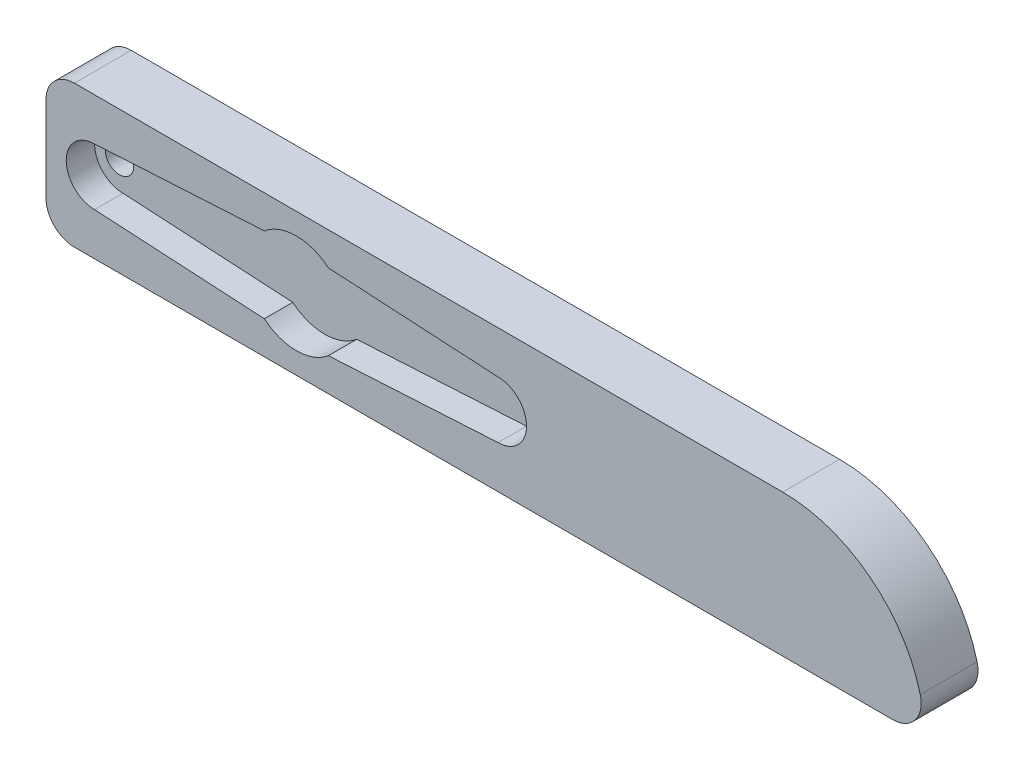
from build123d import *

# Parameters (mm, degrees)
SKETCH1_W           = 50
SKETCH1_H           = 10
BOSS_EXTRUDE1_DEPTH = 4
CUT_EXTRUDE1_DEPTH  = 2
CUT_EXTRUDE2_REACH  = 27.573
SKETCH3_R           = 1
CUT_EXTRUDE3_REACH  = 27.807
SKETCH4_W           = 8.712551382
SKETCH4_H           = 15.185608923
SKETCH5_W           = 19.235166375
SKETCH5_H           = 10
BOSS_EXTRUDE2_DEPTH = 4
FILLET1_R           = 10
FILLET2_R           = 2
FILLET3_R           = 2
FILLET4_R           = 2


with BuildPart() as part:
    # Sketch1 → Boss-Extrude1 (new body)
    with BuildSketch(Plane.XY):
        Rectangle(SKETCH1_W, SKETCH1_H)
    extrude(amount=BOSS_EXTRUDE1_DEPTH)

    # Sketch2 → Cut-Extrude1 (cut)
    with BuildSketch(Plane.XY.offset(4)):
        with BuildLine():
            Line((-2.254530133, 2.677142857), (-14.2, 2))
            ThreePointArc((-14.2, 2), (-16.2, 0), (-14.2, -2))
            Line((-14.2, -2), (-2.254530133, -2.677142857))
            ThreePointArc((-2.254530133, -2.677142857), (0, -3.5), (2.254530133, -2.677142857))
            Line((2.254530133, -2.677142857), (14.2, -2))
            ThreePointArc((14.2, -2), (16.2, 0), (14.2, 2))
            Line((14.2, 2), (2.254530133, 2.677142857))
            ThreePointArc((2.254530133, 2.677142857), (0, 3.5), (-2.254530133, 2.677142857))
        make_face()
    extrude(amount=-CUT_EXTRUDE1_DEPTH, mode=Mode.SUBTRACT)

    # Sketch3 → Cut-Extrude2 (cut, up to next)
    with BuildSketch(Plane.XY.offset(2), mode=Mode.PRIVATE) as cut_extrude2_sk1:
        with Locations((-14.45, 0)):
            Circle(SKETCH3_R)
    cut_extrude2_tool1 = extrude(cut_extrude2_sk1.sketch, amount=-CUT_EXTRUDE2_REACH, mode=Mode.PRIVATE) & part.part
    # Sketch3 → Cut-Extrude2 (cut, up to next)
    with BuildSketch(Plane.XY.offset(2), mode=Mode.PRIVATE) as cut_extrude2_sk2:
        with Locations(Location((14.45, 0, 0), (0, 0, 180))):
            Circle(SKETCH3_R)
    cut_extrude2_tool2 = extrude(cut_extrude2_sk2.sketch, amount=-CUT_EXTRUDE2_REACH, mode=Mode.PRIVATE) & part.part
    add(cut_extrude2_tool1.solids().sort_by_distance((-14.45, 0, 2))[0], mode=Mode.SUBTRACT)
    add(cut_extrude2_tool2.solids().sort_by_distance((14.45, 0, 2))[0], mode=Mode.SUBTRACT)

    # Sketch4 → Cut-Extrude3 (cut, up to next)
    with BuildSketch(Plane.XY.offset(4), mode=Mode.PRIVATE) as cut_extrude3_sk1:
        with Locations((-21.977833235, -0.132061848)):
            Rectangle(SKETCH4_W, SKETCH4_H)
    cut_extrude3_tool1 = extrude(cut_extrude3_sk1.sketch, amount=-CUT_EXTRUDE3_REACH, mode=Mode.PRIVATE) & part.part
    add(cut_extrude3_tool1.solids().sort_by_distance((-21.977833, -0.132062, 4))[0], mode=Mode.SUBTRACT)

    # Sketch5 → Boss-Extrude2 (add)
    with BuildSketch(Plane.XY.offset(4)):
        with Locations((34.617583188, 0)):
            Rectangle(SKETCH5_W, SKETCH5_H)
    extrude(amount=-BOSS_EXTRUDE2_DEPTH)

    # Fillet1
    fillet1_edges = [part.edges().sort_by_distance(p)[0] for p in [
        (44.235166375, 5, 2),
    ]]
    fillet(fillet1_edges, radius=FILLET1_R - 0.0001)  # a hair under: the kernel refuses the full size

    # Fillet2
    fillet2_edges = [part.edges().sort_by_distance(p)[0] for p in [
        (44.235166375, -5, 2),
    ]]
    fillet(fillet2_edges, radius=FILLET2_R)

    # Fillet3
    fillet3_edges = [part.edges().sort_by_distance(p)[0] for p in [
        (-17.621557544, 5, 2),
    ]]
    fillet(fillet3_edges, radius=FILLET3_R)

    # Fillet4
    fillet4_edges = [part.edges().sort_by_distance(p)[0] for p in [
        (-17.621557544, -5, 2),
    ]]
    fillet(fillet4_edges, radius=FILLET4_R)


solid = part.part
